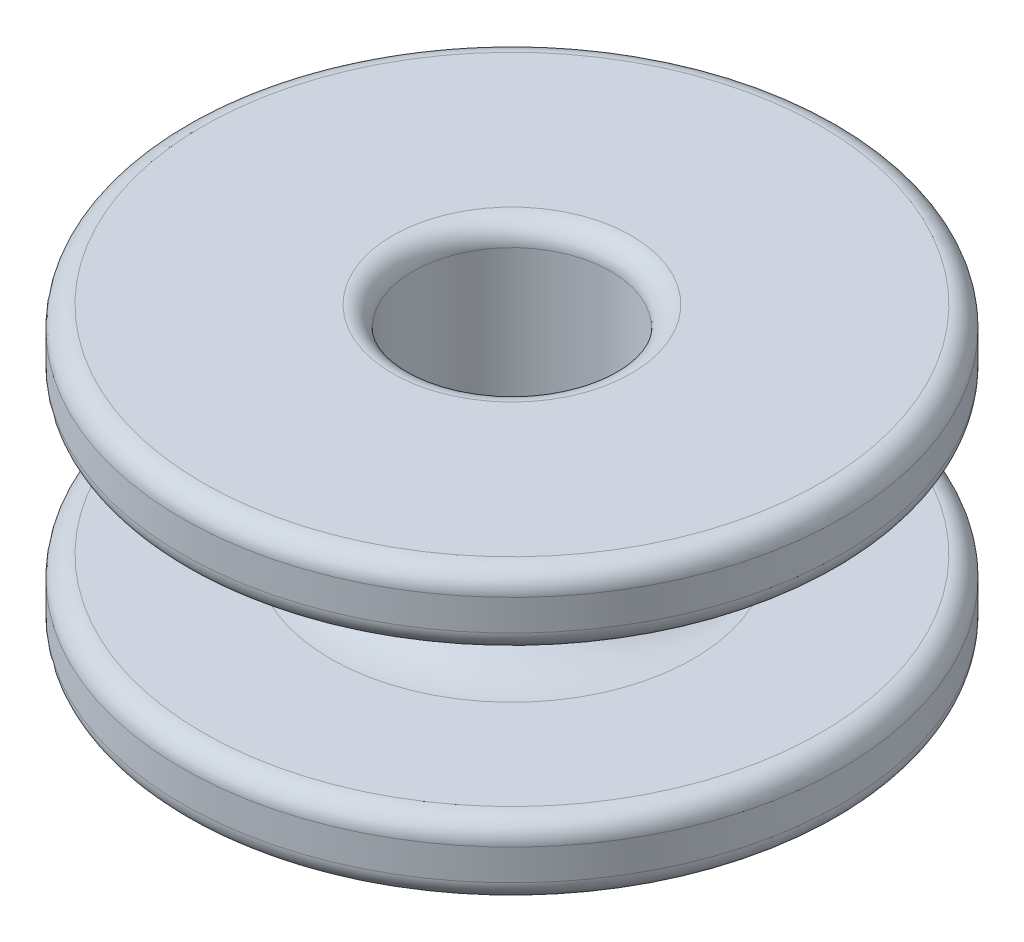
from build123d import *

# Parameters (mm, degrees)
FILLET1_R = 0.5


with BuildPart() as part:
    # Sketch1 → Revolve1 (revolve)
    with BuildSketch(Plane.XY):
        with BuildLine():
            Line((1.2, 3.5), (1.2, -3.5))
            Line((1.2, -3.5), (6.8, -3.5))
            Line((6.8, -3.5), (6.8, -1.75))
            Line((6.8, -1.75), (3.2, -1.75))
            ThreePointArc((3.2, -1.75), (1.45, 0), (3.2, 1.75))
            Line((3.2, 1.75), (6.8, 1.75))
            Line((6.8, 1.75), (6.8, 3.5))
            Line((6.8, 3.5), (1.2, 3.5))
        make_face()
    revolve(axis=Axis((-1.2, -3.5, 0), (0, 1, 0)))

    # Fillet1
    fillet1_edges = [part.edges().sort_by_distance(p)[0] for p in [
        (-3.6, -3.5, 0),
        (-9.2, -3.5, 0),
        (-3.6, 3.5, 0),
        (-9.2, 3.5, 0),
        (-9.2, -1.75, 0),
        (-9.2, 1.75, 0),
    ]]
    fillet(fillet1_edges, radius=FILLET1_R)


solid = part.part
